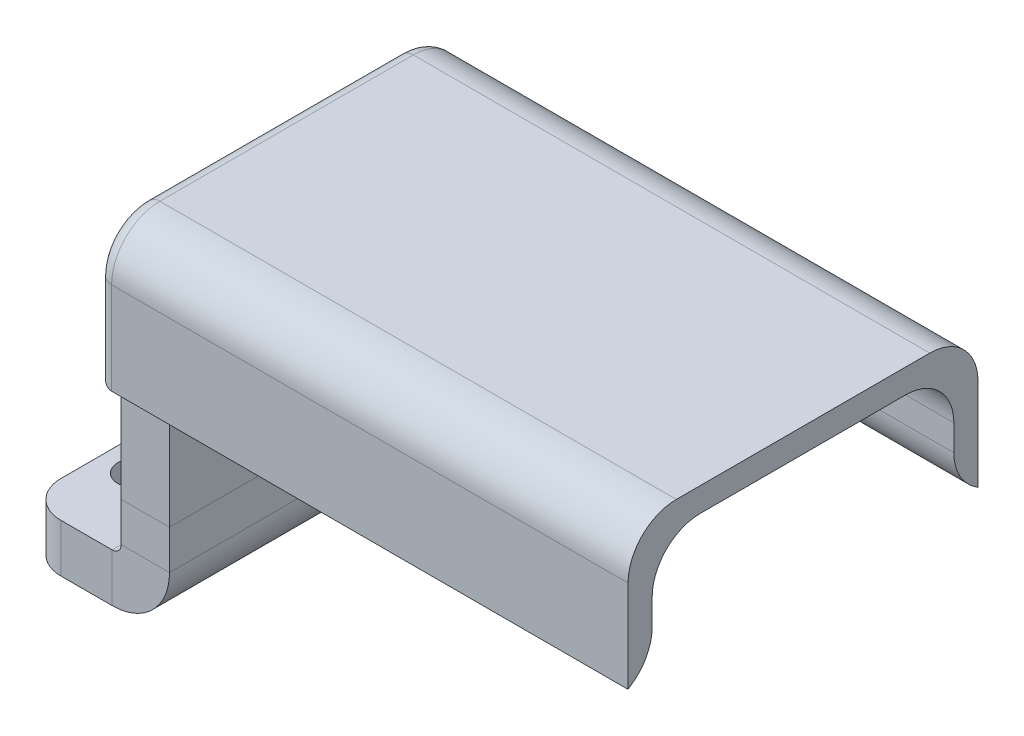
from build123d import *

# Parameters (mm, degrees)
BASE_FLANGE1_DEPTH  = 12.5
FILLET1_R           = 3
SKETCH6_R           = 1.5
CUT_EXTRUDE1_DEPTH  = 18.783419244
BOSS_EXTRUDE1_DEPTH = 4
BOSS_EXTRUDE3_DEPTH = 40
FILLET2_R           = 4
FILLET3_R           = 1.2


# Sheet-metal steps are written as plain solids
with BuildPart() as part:
    # Sketch1 → Base-Flange1 (new, symmetric)
    with BuildSketch(Plane.XY):
        with BuildLine():
            Line((0, 8), (0, 4.75))
            ThreePointArc((0, 4.75), (-1.391242789, 1.391242789), (-4.75, 0))
            Line((-4.75, 0), (-12, 0))
            Line((-12, 0), (-12, 4))
            Line((-12, 4), (-4.75, 4))
            ThreePointArc((-4.75, 4), (-4.219669914, 4.219669914), (-4, 4.75))
            Line((-4, 4.75), (-4, 8))
            Line((-4, 8), (0, 8))
        make_face()
    extrude(amount=BASE_FLANGE1_DEPTH, both=True)

    # Fillet1
    fillet1_edges = [part.edges().sort_by_distance(p)[0] for p in [
        (-12, 2, 12.5),
        (-12, 2, -12.5),
    ]]
    fillet(fillet1_edges, radius=FILLET1_R)

    # Sketch6 → Cut-Extrude1 (cut, through all)
    with BuildSketch(Plane(origin=(0, 4, 0), x_dir=(1, 0, 0), z_dir=(0, 1, 0))):
        with Locations(Location((-9.278968908, 6, 0), (0, 0, 180))):
            Circle(SKETCH6_R)
        with Locations((-9.278968908, -6)):
            Circle(SKETCH6_R)
    extrude(amount=-CUT_EXTRUDE1_DEPTH, mode=Mode.SUBTRACT)


with BuildPart() as body_2:
    # Sketch8 → Boss-Extrude1 (new body)
    with BuildSketch(Plane(origin=(0, 0, 0), x_dir=(0, 0, -1), z_dir=(1, 0, 0))):
        Polygon((-12.5, 18.650635095), (-12.5, 17.365411854), (-12.5, 8), (12.5, 8), (12.5, 17.365411854), (12.5, 18.650635095), align=None)
        with BuildLine():
            ThreePointArc((-8.251909394, 20.598855721), (-10.42157986, 19.724230971), (-12.5, 18.650635095))
            Line((-12.5, 18.650635095), (12.5, 18.650635095))
            ThreePointArc((12.5, 18.650635095), (10.42157986, 19.724230971), (8.251909394, 20.598855721))
            ThreePointArc((8.251909394, 20.598855721), (6.844608492, 20.568558373), (5.672455033, 21.347962007))
            ThreePointArc((5.672455033, 21.347962007), (0, 22), (-5.672455033, 21.347962007))
            ThreePointArc((-5.672455033, 21.347962007), (-6.844608492, 20.568558373), (-8.251909394, 20.598855721))
        make_face()
        with BuildLine():
            Line((-12.5, 27), (-12.5, 22.825317547))
            Line((-12.5, 22.825317547), (-9.85, 22.825317547))
            ThreePointArc((-9.85, 22.825317547), (-7.5, 25.175317547), (-5.15, 22.825317547))
            Line((-5.15, 22.825317547), (5.15, 22.825317547))
            ThreePointArc((5.15, 22.825317547), (7.5, 25.175317547), (9.85, 22.825317547))
            Line((9.85, 22.825317547), (12.5, 22.825317547))
            Line((12.5, 22.825317547), (12.5, 27))
            Line((12.5, 27), (-12.5, 27))
        make_face()
        with BuildLine():
            ThreePointArc((8.251909394, 20.598855721), (10.42157986, 19.724230971), (12.5, 18.650635095))
            Line((12.5, 18.650635095), (12.5, 22.825317547))
            Line((12.5, 22.825317547), (9.85, 22.825317547))
            ThreePointArc((9.85, 22.825317547), (9.409121143, 21.455005006), (8.251909394, 20.598855721))
        make_face()
        with BuildLine():
            ThreePointArc((-5.15, 22.825317547), (-5.284460486, 22.041809626), (-5.672455033, 21.347962007))
            ThreePointArc((-5.672455033, 21.347962007), (0, 22), (5.672455033, 21.347962007))
            ThreePointArc((5.672455033, 21.347962007), (5.284460486, 22.041809626), (5.15, 22.825317547))
            Line((5.15, 22.825317547), (-5.15, 22.825317547))
        make_face()
        with BuildLine():
            Line((-12.5, 22.825317547), (-12.5, 18.650635095))
            ThreePointArc((-12.5, 18.650635095), (-10.42157986, 19.724230971), (-8.251909394, 20.598855721))
            ThreePointArc((-8.251909394, 20.598855721), (-9.409121143, 21.455005006), (-9.85, 22.825317547))
            Line((-9.85, 22.825317547), (-12.5, 22.825317547))
        make_face()
        Polygon((-14.5, 29), (-14.5, 22.825317547), (-12.5, 22.825317547), (-12.5, 27), (12.5, 27), (12.5, 22.825317547), (14.5, 22.825317547), (14.5, 29), align=None)
        with BuildLine():
            Line((12.5, 22.825317547), (12.5, 18.650635095))
            ThreePointArc((12.5, 18.650635095), (13.515285779, 18.031810438), (14.5, 17.365411854))
            Line((14.5, 17.365411854), (14.5, 18.650635095))
            Line((14.5, 18.650635095), (14.5, 22.825317547))
            Line((14.5, 22.825317547), (12.5, 22.825317547))
        make_face()
        with BuildLine():
            Line((-14.5, 22.825317547), (-14.5, 18.650635095))
            Line((-14.5, 18.650635095), (-14.5, 17.365411854))
            ThreePointArc((-14.5, 17.365411854), (-13.515285779, 18.031810438), (-12.5, 18.650635095))
            Line((-12.5, 18.650635095), (-12.5, 22.825317547))
            Line((-12.5, 22.825317547), (-14.5, 22.825317547))
        make_face()
    extrude(amount=-BOSS_EXTRUDE1_DEPTH)

    # Sketch8<4> → Boss-Extrude3 (add)
    with BuildSketch(Plane(origin=(0, 0, 0), x_dir=(0, 0, -1), z_dir=(1, 0, 0))):
        Polygon((-14.5, 29), (-14.5, 22.825317547), (-12.5, 22.825317547), (-12.5, 27), (12.5, 27), (12.5, 22.825317547), (14.5, 22.825317547), (14.5, 29), align=None)
        with BuildLine():
            Line((-14.5, 22.825317547), (-14.5, 18.650635095))
            Line((-14.5, 18.650635095), (-14.5, 17.365411854))
            ThreePointArc((-14.5, 17.365411854), (-13.515285779, 18.031810438), (-12.5, 18.650635095))
            Line((-12.5, 18.650635095), (-12.5, 22.825317547))
            Line((-12.5, 22.825317547), (-14.5, 22.825317547))
        make_face()
        with BuildLine():
            Line((12.5, 22.825317547), (12.5, 18.650635095))
            ThreePointArc((12.5, 18.650635095), (13.515285779, 18.031810438), (14.5, 17.365411854))
            Line((14.5, 17.365411854), (14.5, 18.650635095))
            Line((14.5, 18.650635095), (14.5, 22.825317547))
            Line((14.5, 22.825317547), (12.5, 22.825317547))
        make_face()
    extrude(amount=BOSS_EXTRUDE3_DEPTH)

    # Fillet2
    fillet2_edges = [body_2.edges().sort_by_distance(p)[0] for p in [
        (18, 29, 14.5),
        (18, 29, -14.5),
        (20, 18.650635095, 12.5),
        (20, 27, 12.5),
        (20, 27, -12.5),
        (20, 18.650635095, -12.5),
    ]]
    fillet(fillet2_edges, radius=FILLET2_R)

    # Fillet3
    fillet3_edges = [body_2.edges().sort_by_distance(p)[0] for p in [
        (-4, 21.182705927, 14.5),
        (-4, 29, 0),
        (-4, 21.182705927, -14.5),
        (-4, 27.828427125, -13.328427125),
        (-4, 27.828427125, 13.328427125),
    ]]
    fillet(fillet3_edges, radius=FILLET3_R)


solid = Compound([part.part, body_2.part])
